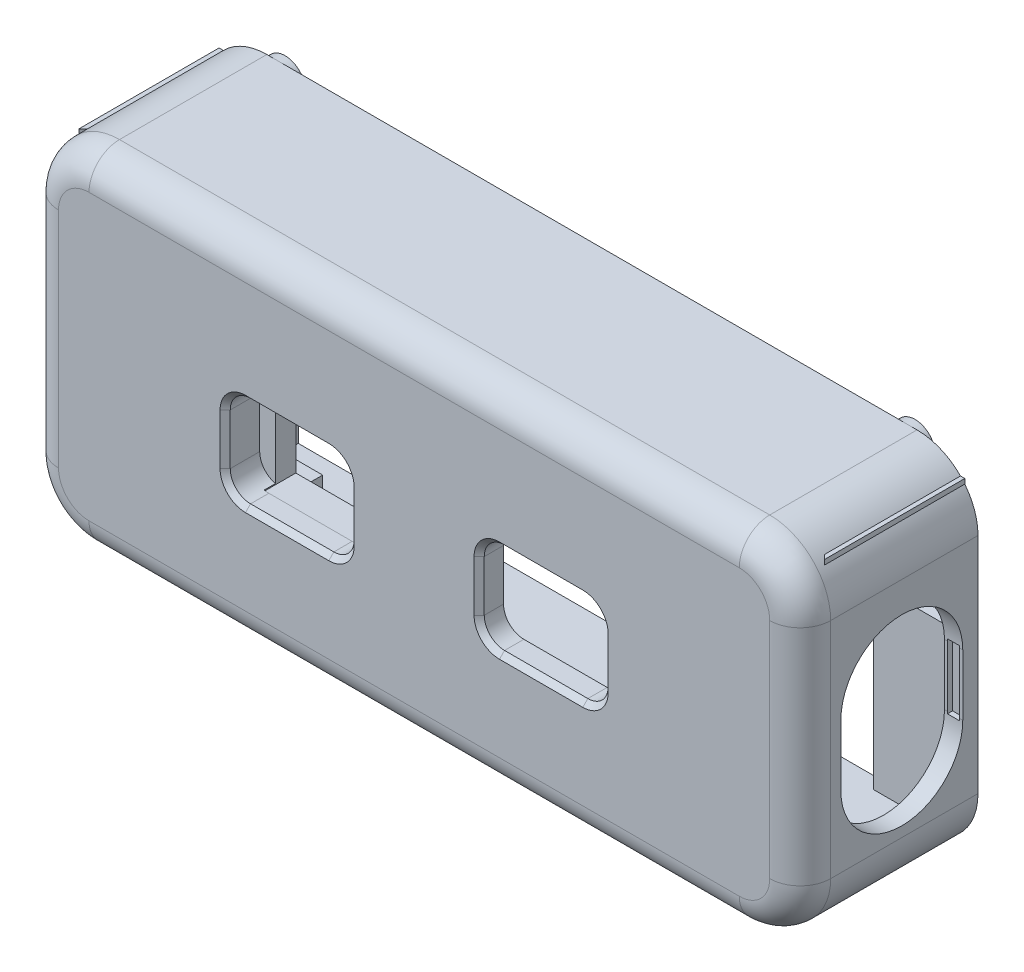
from build123d import *

# Parameters (mm, degrees)
BOSS_EXTRUDE1_START  = 80.8
BOSS_EXTRUDE1_DEPTH  = 17.5
FILLET1_R            = 3
BOSS_EXTRUDE2_START  = 79.8
BOSS_EXTRUDE2_DEPTH  = 16.1
BOSS_EXTRUDE3_START  = 80.8
SKETCH3_W            = 7.8
SKETCH3_H            = 6.91
BOSS_EXTRUDE3_DEPTH  = 6
BOSS_EXTRUDE4_START  = 65.3
BOSS_EXTRUDE4_DEPTH  = 6.91
BOSS_EXTRUDE5_START  = 80.8
SKETCH5_W            = 7.31
SKETCH5_H            = 17.61
BOSS_EXTRUDE5_DEPTH  = 1.2
BOSS_EXTRUDE6_START  = 85.3
SKETCH6_W            = 4
SKETCH6_H            = 3.01
BOSS_EXTRUDE6_DEPTH  = 2
BOSS_EXTRUDE7_START  = 85.3
SKETCH7_W            = 4
SKETCH7_H            = 3.01
BOSS_EXTRUDE7_DEPTH  = 2
BOSS_EXTRUDE8_START  = -39
BOSS_EXTRUDE8_DEPTH  = 3.3
BOSS_EXTRUDE9_START  = 81.8
SKETCH9_W            = 1.2
SKETCH9_H            = 6.4
BOSS_EXTRUDE9_DEPTH  = 0.6
BOSS_EXTRUDE10_START = 94.2
SKETCH10_W           = 1.2
SKETCH10_H           = 6.4
BOSS_EXTRUDE10_DEPTH = 0.6
BOSS_EXTRUDE11_START = 80.8
SKETCH11_W           = 7.8
SKETCH11_H           = 6.91
BOSS_EXTRUDE11_DEPTH = 6
BOSS_EXTRUDE12_START = 65.3
BOSS_EXTRUDE12_DEPTH = 6.91
BOSS_EXTRUDE13_START = 80.8
SKETCH13_W           = 7.31
SKETCH13_H           = 17.61
BOSS_EXTRUDE13_DEPTH = 1.2
BOSS_EXTRUDE14_START = 85.3
SKETCH14_W           = 4
SKETCH14_H           = 3.01
BOSS_EXTRUDE14_DEPTH = 2
BOSS_EXTRUDE15_START = 85.3
SKETCH15_W           = 4
SKETCH15_H           = 3.01
BOSS_EXTRUDE15_DEPTH = 2
BOSS_EXTRUDE16_START = 35.7
BOSS_EXTRUDE16_DEPTH = 3.3
BOSS_EXTRUDE17_START = 81.8
SKETCH17_W           = 1.2
SKETCH17_H           = 6.4
BOSS_EXTRUDE17_DEPTH = 0.6
BOSS_EXTRUDE18_START = 94.2
SKETCH18_W           = 1.2
SKETCH18_H           = 6.4
BOSS_EXTRUDE18_DEPTH = 0.6
BOSS_EXTRUDE19_START = 80
SKETCH19_R           = 2
BOSS_EXTRUDE19_DEPTH = 0.81
BOSS_EXTRUDE20_START = 79.8
SKETCH20_R           = 1
BOSS_EXTRUDE20_DEPTH = 8
BOSS_EXTRUDE21_START = 80
SKETCH21_R           = 2
BOSS_EXTRUDE21_DEPTH = 0.81
BOSS_EXTRUDE22_START = 79.8
SKETCH22_R           = 1
BOSS_EXTRUDE22_DEPTH = 8
BOSS_EXTRUDE23_START = 80
SKETCH23_R           = 2
BOSS_EXTRUDE23_DEPTH = 0.81
BOSS_EXTRUDE24_START = 79.8
SKETCH24_R           = 1
BOSS_EXTRUDE24_DEPTH = 8
BOSS_EXTRUDE25_START = 80
SKETCH25_R           = 2
BOSS_EXTRUDE25_DEPTH = 0.81
BOSS_EXTRUDE26_START = 79.8
SKETCH26_R           = 1
BOSS_EXTRUDE26_DEPTH = 8
BOSS_EXTRUDE27_START = 92.9
SKETCH27_W           = 13
SKETCH27_H           = 13
BOSS_EXTRUDE27_DEPTH = 3.01
BOSS_EXTRUDE28_START = 91.9
SKETCH28_W           = 9.1
SKETCH28_H           = 9.1
BOSS_EXTRUDE28_DEPTH = 4.1
BOSS_EXTRUDE29_START = 93.4
SKETCH29_W           = 20.6
SKETCH29_H           = 6.21
BOSS_EXTRUDE29_DEPTH = 2.51
BOSS_EXTRUDE30_START = 93.4
SKETCH30_W           = 1.2
SKETCH30_H           = 29.82
BOSS_EXTRUDE30_DEPTH = 2.51
BOSS_EXTRUDE31_START = 93.4
SKETCH31_W           = 1.2
SKETCH31_H           = 29.82
BOSS_EXTRUDE31_DEPTH = 2.51
BOSS_EXTRUDE32_START = 94.9
BOSS_EXTRUDE32_DEPTH = 4.4
CHAMFER1_SIZE        = 0.5
BOSS_EXTRUDE33_START = 94.9
BOSS_EXTRUDE33_DEPTH = 4.4
CHAMFER2_SIZE        = 0.5


with BuildPart() as part:
    # Sketch1 → Boss-Extrude1 (new body)
    with BuildSketch(Plane.XY.offset(BOSS_EXTRUDE1_START)):
        with BuildLine():
            Line((-32, 40), (32, 40))
            ThreePointArc((32, 40), (36.242640687, 41.757359313), (38, 46))
            Line((38, 46), (38, 68))
            ThreePointArc((38, 68), (36.242640687, 72.242640687), (32, 74))
            Line((32, 74), (-32, 74))
            ThreePointArc((-32, 74), (-36.242640687, 72.242640687), (-38, 68))
            Line((-38, 68), (-38, 46))
            ThreePointArc((-38, 46), (-36.242640687, 41.757359313), (-32, 40))
        make_face()
    extrude(amount=BOSS_EXTRUDE1_DEPTH)

    # Fillet1
    fillet1_edges = [part.edges().sort_by_distance(p)[0] for p in [
        (36.242640687, 72.242640687, 98.3),
        (38, 57, 98.3),
        (36.242640687, 41.757359313, 98.3),
        (0, 40, 98.3),
        (-36.242640687, 41.757359313, 98.3),
        (-38, 57, 98.3),
        (-36.242640687, 72.242640687, 98.3),
        (0, 74, 98.3),
    ]]
    fillet(fillet1_edges, radius=FILLET1_R)


with BuildPart() as body_2:
    # Sketch2 → Boss-Extrude2 (new body)
    with BuildSketch(Plane.XY.offset(BOSS_EXTRUDE2_START)):
        with BuildLine():
            Line((-32.6, 42.4), (32.6, 42.4))
            ThreePointArc((32.6, 42.4), (35.145584412, 43.454415588), (36.2, 46))
            Line((36.2, 46), (36.2, 68))
            ThreePointArc((36.2, 68), (34.969848481, 70.969848481), (32, 72.2))
            Line((32, 72.2), (-32, 72.2))
            ThreePointArc((-32, 72.2), (-34.969848481, 70.969848481), (-36.2, 68))
            Line((-36.2, 68), (-36.2, 46))
            ThreePointArc((-36.2, 46), (-35.145584412, 43.454415588), (-32.6, 42.4))
        make_face()
    extrude(amount=BOSS_EXTRUDE2_DEPTH)


with BuildPart() as part_1:
    add(part.part)

    # Combine1: cut body 2
    add(body_2.part, mode=Mode.SUBTRACT)

    # Sketch3 → Boss-Extrude3 (add)
    with BuildSketch(Plane.XY.offset(BOSS_EXTRUDE3_START)):
        with Locations((-32.8, 68.755)):
            Rectangle(SKETCH3_W, SKETCH3_H)
    extrude(amount=BOSS_EXTRUDE3_DEPTH)

    # Sketch4 → Boss-Extrude4 (add)
    with BuildSketch(Plane(origin=(0, 0, 0), x_dir=(1, 0, 0), z_dir=(0, 1, 0)).offset(BOSS_EXTRUDE4_START)):
        Polygon((-28.9, -86.8), (-36.7, -86.8), (-36.7, -94.6), align=None)
    extrude(amount=BOSS_EXTRUDE4_DEPTH)

    # Sketch5 → Boss-Extrude5 (add)
    with BuildSketch(Plane.XY.offset(BOSS_EXTRUDE5_START)):
        with Locations((-32.555, 51.195)):
            Rectangle(SKETCH5_W, SKETCH5_H)
    extrude(amount=BOSS_EXTRUDE5_DEPTH)

    # Sketch6 → Boss-Extrude6 (add)
    with BuildSketch(Plane.XY.offset(BOSS_EXTRUDE6_START)):
        with Locations((-24, 43.895)):
            Rectangle(SKETCH6_W, SKETCH6_H)
    extrude(amount=BOSS_EXTRUDE6_DEPTH)

    # Sketch7 → Boss-Extrude7 (add)
    with BuildSketch(Plane.XY.offset(BOSS_EXTRUDE7_START)):
        with Locations((-24, 70.705)):
            Rectangle(SKETCH7_W, SKETCH7_H)
    extrude(amount=BOSS_EXTRUDE7_DEPTH)


with BuildPart() as body_2_2:
    # Sketch8 → Boss-Extrude8 (new body)
    with BuildSketch(Plane(origin=(0, 0, 0), x_dir=(0, 0, -1), z_dir=(1, 0, 0)).offset(BOSS_EXTRUDE8_START)):
        with BuildLine():
            Line((-94.3, 53), (-94.3, 59))
            ThreePointArc((-94.3, 59), (-92.542640687, 63.242640687), (-88.3, 65))
            ThreePointArc((-88.3, 65), (-84.057359313, 63.242640687), (-82.3, 59))
            Line((-82.3, 59), (-82.3, 53))
            ThreePointArc((-82.3, 53), (-84.057359313, 48.757359313), (-88.3, 47))
            ThreePointArc((-88.3, 47), (-92.542640687, 48.757359313), (-94.3, 53))
        make_face()
    extrude(amount=BOSS_EXTRUDE8_DEPTH)


with BuildPart() as part_2:
    add(part_1.part)

    # Combine2: cut body 2 2
    add(body_2_2.part, mode=Mode.SUBTRACT)


with BuildPart() as body_2_3:
    # Sketch9 → Boss-Extrude9 (new body)
    with BuildSketch(Plane.XY.offset(BOSS_EXTRUDE9_START)):
        with Locations((-37.1, 56)):
            Rectangle(SKETCH9_W, SKETCH9_H)
    extrude(amount=BOSS_EXTRUDE9_DEPTH)


with BuildPart() as part_3:
    add(part_2.part)

    # Combine3: cut body 2 3
    add(body_2_3.part, mode=Mode.SUBTRACT)


with BuildPart() as body_2_4:
    # Sketch10 → Boss-Extrude10 (new body)
    with BuildSketch(Plane.XY.offset(BOSS_EXTRUDE10_START)):
        with Locations((-37.1, 56)):
            Rectangle(SKETCH10_W, SKETCH10_H)
    extrude(amount=BOSS_EXTRUDE10_DEPTH)


with BuildPart() as part_4:
    add(part_3.part)

    # Combine4: cut body 2 4
    add(body_2_4.part, mode=Mode.SUBTRACT)

    # Sketch11 → Boss-Extrude11 (add)
    with BuildSketch(Plane.XY.offset(BOSS_EXTRUDE11_START)):
        with Locations((32.8, 68.755)):
            Rectangle(SKETCH11_W, SKETCH11_H)
    extrude(amount=BOSS_EXTRUDE11_DEPTH)

    # Sketch12 → Boss-Extrude12 (add)
    with BuildSketch(Plane(origin=(0, 0, 0), x_dir=(1, 0, 0), z_dir=(0, 1, 0)).offset(BOSS_EXTRUDE12_START)):
        Polygon((28.9, -86.8), (36.7, -86.8), (36.7, -94.6), align=None)
    extrude(amount=BOSS_EXTRUDE12_DEPTH)

    # Sketch13 → Boss-Extrude13 (add)
    with BuildSketch(Plane.XY.offset(BOSS_EXTRUDE13_START)):
        with Locations((32.555, 51.195)):
            Rectangle(SKETCH13_W, SKETCH13_H)
    extrude(amount=BOSS_EXTRUDE13_DEPTH)

    # Sketch14 → Boss-Extrude14 (add)
    with BuildSketch(Plane.XY.offset(BOSS_EXTRUDE14_START)):
        with Locations((24, 43.895)):
            Rectangle(SKETCH14_W, SKETCH14_H)
    extrude(amount=BOSS_EXTRUDE14_DEPTH)

    # Sketch15 → Boss-Extrude15 (add)
    with BuildSketch(Plane.XY.offset(BOSS_EXTRUDE15_START)):
        with Locations((24, 70.705)):
            Rectangle(SKETCH15_W, SKETCH15_H)
    extrude(amount=BOSS_EXTRUDE15_DEPTH)


with BuildPart() as body_2_5:
    # Sketch16 → Boss-Extrude16 (new body)
    with BuildSketch(Plane(origin=(0, 0, 0), x_dir=(0, 0, -1), z_dir=(1, 0, 0)).offset(BOSS_EXTRUDE16_START)):
        with BuildLine():
            Line((-94.3, 53), (-94.3, 59))
            ThreePointArc((-94.3, 59), (-92.542640687, 63.242640687), (-88.3, 65))
            ThreePointArc((-88.3, 65), (-84.057359313, 63.242640687), (-82.3, 59))
            Line((-82.3, 59), (-82.3, 53))
            ThreePointArc((-82.3, 53), (-84.057359313, 48.757359313), (-88.3, 47))
            ThreePointArc((-88.3, 47), (-92.542640687, 48.757359313), (-94.3, 53))
        make_face()
    extrude(amount=BOSS_EXTRUDE16_DEPTH)


with BuildPart() as part_5:
    add(part_4.part)

    # Combine5: cut body 2 5
    add(body_2_5.part, mode=Mode.SUBTRACT)


with BuildPart() as body_2_6:
    # Sketch17 → Boss-Extrude17 (new body)
    with BuildSketch(Plane.XY.offset(BOSS_EXTRUDE17_START)):
        with Locations((37.1, 56)):
            Rectangle(SKETCH17_W, SKETCH17_H)
    extrude(amount=BOSS_EXTRUDE17_DEPTH)


with BuildPart() as part_6:
    add(part_5.part)

    # Combine6: cut body 2 6
    add(body_2_6.part, mode=Mode.SUBTRACT)


with BuildPart() as body_2_7:
    # Sketch18 → Boss-Extrude18 (new body)
    with BuildSketch(Plane.XY.offset(BOSS_EXTRUDE18_START)):
        with Locations((37.1, 56)):
            Rectangle(SKETCH18_W, SKETCH18_H)
    extrude(amount=BOSS_EXTRUDE18_DEPTH)


with BuildPart() as part_7:
    add(part_6.part)

    # Combine7: cut body 2 7
    add(body_2_7.part, mode=Mode.SUBTRACT)

    # Sketch19 → Boss-Extrude19 (add)
    with BuildSketch(Plane.XY.offset(BOSS_EXTRUDE19_START)):
        with Locations((-31, 68.3)):
            Circle(SKETCH19_R)
    extrude(amount=BOSS_EXTRUDE19_DEPTH)


with BuildPart() as body_2_8:
    # Sketch20 → Boss-Extrude20 (new body)
    with BuildSketch(Plane.XY.offset(BOSS_EXTRUDE20_START)):
        with Locations((-31, 68.3)):
            Circle(SKETCH20_R)
    extrude(amount=BOSS_EXTRUDE20_DEPTH)


with BuildPart() as part_8:
    add(part_7.part)

    # Combine8: cut body 2 8
    add(body_2_8.part, mode=Mode.SUBTRACT)

    # Sketch21 → Boss-Extrude21 (add)
    with BuildSketch(Plane.XY.offset(BOSS_EXTRUDE21_START)):
        with Locations((-31, 72)):
            Circle(SKETCH21_R)
    extrude(amount=BOSS_EXTRUDE21_DEPTH)


with BuildPart() as body_2_9:
    # Sketch22 → Boss-Extrude22 (new body)
    with BuildSketch(Plane.XY.offset(BOSS_EXTRUDE22_START)):
        with Locations((-31, 72)):
            Circle(SKETCH22_R)
    extrude(amount=BOSS_EXTRUDE22_DEPTH)


with BuildPart() as part_9:
    add(part_8.part)

    # Combine9: cut body 2 9
    add(body_2_9.part, mode=Mode.SUBTRACT)

    # Sketch23 → Boss-Extrude23 (add)
    with BuildSketch(Plane.XY.offset(BOSS_EXTRUDE23_START)):
        with Locations((31, 68.3)):
            Circle(SKETCH23_R)
    extrude(amount=BOSS_EXTRUDE23_DEPTH)


with BuildPart() as body_2_10:
    # Sketch24 → Boss-Extrude24 (new body)
    with BuildSketch(Plane.XY.offset(BOSS_EXTRUDE24_START)):
        with Locations((31, 68.3)):
            Circle(SKETCH24_R)
    extrude(amount=BOSS_EXTRUDE24_DEPTH)


with BuildPart() as part_10:
    add(part_9.part)

    # Combine10: cut body 2 10
    add(body_2_10.part, mode=Mode.SUBTRACT)

    # Sketch25 → Boss-Extrude25 (add)
    with BuildSketch(Plane.XY.offset(BOSS_EXTRUDE25_START)):
        with Locations((31, 72)):
            Circle(SKETCH25_R)
    extrude(amount=BOSS_EXTRUDE25_DEPTH)


with BuildPart() as body_2_11:
    # Sketch26 → Boss-Extrude26 (new body)
    with BuildSketch(Plane.XY.offset(BOSS_EXTRUDE26_START)):
        with Locations((31, 72)):
            Circle(SKETCH26_R)
    extrude(amount=BOSS_EXTRUDE26_DEPTH)


with BuildPart() as part_11:
    add(part_10.part)

    # Combine11: cut body 2 11
    add(body_2_11.part, mode=Mode.SUBTRACT)

    # Sketch27 → Boss-Extrude27 (add)
    with BuildSketch(Plane.XY.offset(BOSS_EXTRUDE27_START)):
        with Locations((-12.5, 56.4)):
            Rectangle(SKETCH27_W, SKETCH27_H)
    extrude(amount=BOSS_EXTRUDE27_DEPTH)


with BuildPart() as body_2_12:
    # Sketch28 → Boss-Extrude28 (new body)
    with BuildSketch(Plane.XY.offset(BOSS_EXTRUDE28_START)):
        with Locations((-12.5, 56.4)):
            Rectangle(SKETCH28_W, SKETCH28_H)
    extrude(amount=BOSS_EXTRUDE28_DEPTH)


with BuildPart() as part_12:
    add(part_11.part)

    # Combine12: cut body 2 12
    add(body_2_12.part, mode=Mode.SUBTRACT)

    # Sketch29 → Boss-Extrude29 (add)
    with BuildSketch(Plane.XY.offset(BOSS_EXTRUDE29_START)):
        with Locations((12.5, 45.495)):
            Rectangle(SKETCH29_W, SKETCH29_H)
    extrude(amount=BOSS_EXTRUDE29_DEPTH)

    # Sketch30 → Boss-Extrude30 (add)
    with BuildSketch(Plane.XY.offset(BOSS_EXTRUDE30_START)):
        with Locations((1.6, 57.3)):
            Rectangle(SKETCH30_W, SKETCH30_H)
    extrude(amount=BOSS_EXTRUDE30_DEPTH)

    # Sketch31 → Boss-Extrude31 (add)
    with BuildSketch(Plane.XY.offset(BOSS_EXTRUDE31_START)):
        with Locations((23.4, 57.3)):
            Rectangle(SKETCH31_W, SKETCH31_H)
    extrude(amount=BOSS_EXTRUDE31_DEPTH)


with BuildPart() as body_2_13:
    # Sketch32 → Boss-Extrude32 (new body)
    with BuildSketch(Plane.XY.offset(BOSS_EXTRUDE32_START)):
        with BuildLine():
            Line((-16.6, 51.9), (-8.4, 51.9))
            ThreePointArc((-8.4, 51.9), (-6.985786438, 52.485786438), (-6.4, 53.9))
            Line((-6.4, 53.9), (-6.4, 58.9))
            ThreePointArc((-6.4, 58.9), (-6.985786438, 60.314213562), (-8.4, 60.9))
            Line((-8.4, 60.9), (-16.6, 60.9))
            ThreePointArc((-16.6, 60.9), (-18.014213562, 60.314213562), (-18.6, 58.9))
            Line((-18.6, 58.9), (-18.6, 53.9))
            ThreePointArc((-18.6, 53.9), (-18.014213562, 52.485786438), (-16.6, 51.9))
        make_face()
    extrude(amount=BOSS_EXTRUDE32_DEPTH)


with BuildPart() as part_13:
    add(part_12.part)

    # Combine13: cut body 2 13
    add(body_2_13.part, mode=Mode.SUBTRACT)

    # Chamfer1
    chamfer1_edges = [part_13.edges().sort_by_distance(p)[0] for p in [
        (-12.5, 51.9, 98.3),
        (-18.014213562, 52.485786438, 98.3),
        (-6.985786438, 52.485786438, 98.3),
        (-18.6, 56.4, 98.3),
        (-6.4, 56.4, 98.3),
        (-18.014213562, 60.314213562, 98.3),
        (-6.985786438, 60.314213562, 98.3),
        (-12.5, 60.9, 98.3),
    ]]
    chamfer(chamfer1_edges, length=CHAMFER1_SIZE)


with BuildPart() as body_2_14:
    # Sketch33 → Boss-Extrude33 (new body)
    with BuildSketch(Plane.XY.offset(BOSS_EXTRUDE33_START)):
        with BuildLine():
            Line((8.4, 51.9), (16.6, 51.9))
            ThreePointArc((16.6, 51.9), (18.014213562, 52.485786438), (18.6, 53.9))
            Line((18.6, 53.9), (18.6, 58.9))
            ThreePointArc((18.6, 58.9), (18.014213562, 60.314213562), (16.6, 60.9))
            Line((16.6, 60.9), (8.4, 60.9))
            ThreePointArc((8.4, 60.9), (6.985786438, 60.314213562), (6.4, 58.9))
            Line((6.4, 58.9), (6.4, 53.9))
            ThreePointArc((6.4, 53.9), (6.985786438, 52.485786438), (8.4, 51.9))
        make_face()
    extrude(amount=BOSS_EXTRUDE33_DEPTH)


with BuildPart() as part_14:
    add(part_13.part)

    # Combine14: cut body 2 14
    add(body_2_14.part, mode=Mode.SUBTRACT)

    # Chamfer2
    chamfer2_edges = [part_14.edges().sort_by_distance(p)[0] for p in [
        (12.5, 51.9, 98.3),
        (6.985786438, 52.485786438, 98.3),
        (18.014213562, 52.485786438, 98.3),
        (6.4, 56.4, 98.3),
        (18.6, 56.4, 98.3),
        (6.985786438, 60.314213562, 98.3),
        (18.014213562, 60.314213562, 98.3),
        (12.5, 60.9, 98.3),
    ]]
    chamfer(chamfer2_edges, length=CHAMFER2_SIZE)


solid = part_14.part
